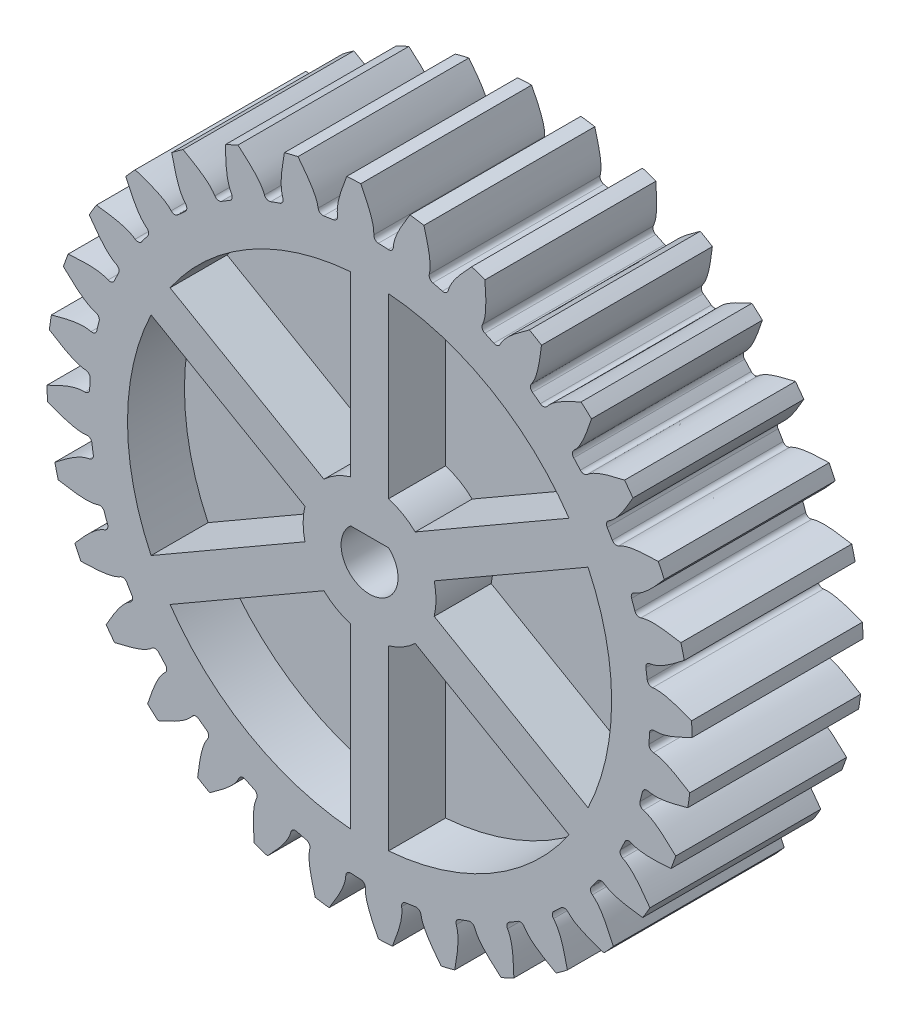
from build123d import *
from build123d.topology import SkipClean

# Parameters (mm, degrees)
ESQUISSE1_R                        = 14.75
BASE_EXTRUSION_DEPTH               = 9
BOSS_EXTRU_1_DEPTH                 = 9
CONG_1_R                           = 0.25
R_P_TITION_CIRCULAIRE1_COUNT       = 32
CONG_1_OF_R_P_TITION_CIRCULAIRE1_R = 0.25
ENL_V_MAT_EXTRU_2_DEPTH            = 26.662667175
BOSS_EXTRU_2_START                 = 5
ESQUISSE5_R                        = 3.5
BOSS_EXTRU_2_DEPTH                 = 5
ENL_V_START                        = -3
ENL_V_MAT_EXTRU_4_DEPTH            = 3
R_P_TITION_CIRCULAIRE2_COUNT       = 6
SYM_TRIE1_START                    = -3
SYM_TRIE1_COPY_1_DEPTH             = 3
SYM_TRIE1_COPY_2_DEPTH             = 3
SYM_TRIE1_COPY_3_DEPTH             = 3
SYM_TRIE1_COPY_4_DEPTH             = 3
SYM_TRIE1_COPY_5_DEPTH             = 3


# Read off the part's stored shape, not the designer's step: Boss.-Extru.1
with BuildPart() as part:
    # Esquisse1 → Base-Extrusion (new body)
    with BuildSketch(Plane.XY):
        Circle(ESQUISSE1_R)
    extrude(amount=BASE_EXTRUSION_DEPTH)

    # Boss.-Extru.1 outline → Boss.-Extru.1 (add)
    with BuildSketch(Plane.XY):
        with BuildLine():
            ThreePointArc((14.658786944, 1.637823355), (14.732296168, 0.722460814), (14.748701662, -0.195702051))
            add(Edge.make_bspline(
                [(14.748701662, -0.195702051), (14.843220422, -0.212864525), (15.265923378, -0.25770261), (16.050131741, -0.009955004), (16.668935437, 0.299779983), (16.993711748, 0.462342985)],
                knots=[0.34511947, 0.34511947, 0.34511947, 0.34511947, 0.424486026, 0.697944103, 1, 1, 1, 1], degree=3))
            ThreePointArc((16.993711748, 0.462342985), (16.979595583, 0.832666701), (16.957410355, 1.202594716))
            add(Edge.make_bspline(
                [(16.957410355, 1.202594716), (16.618286686, 1.332600558), (15.972146643, 1.580303648), (15.167460614, 1.750133059), (14.751172957, 1.664151499), (14.658786944, 1.637823355)],
                knots=[0, 0, 0, 0, 0.302055897, 0.575513974, 0.65488053, 0.65488053, 0.65488053, 0.65488053], degree=3))
        make_face()
    boss_extru_1 = extrude(amount=BOSS_EXTRU_1_DEPTH)

    # Congé1
    cong_1_edges = [part.edges().sort_by_distance(p)[0] for p in [
        (14.748701662, -0.195702051, 4.5),
        (14.658786944, 1.637823355, 4.5),
    ]]
    fillet(cong_1_edges, radius=CONG_1_R)

    # Répétition circulaire1: Boss.-Extru.1 ×32 about axis
    r_p_tition_circulaire1_axis = Axis((0, 0, -50), (0, 0, 1))
    for i in range(1, R_P_TITION_CIRCULAIRE1_COUNT):
        add(boss_extru_1.rotate(r_p_tition_circulaire1_axis, i * 360 / R_P_TITION_CIRCULAIRE1_COUNT))

    # Congé1 of Répétition circulaire1
    cong_1_of_r_p_tition_circulaire1_edges = [part.edges().sort_by_distance(p)[0] for p in [
        (14.503489071, 2.685387266, 4.5),
        (14.057598978, 4.466140504, 4.5),
        (13.700915529, 5.463278656, 4.5),
        (12.916185366, 7.122826378, 4.5),
        (12.371823487, 8.031219311, 4.5),
        (11.278409994, 9.505786028, 4.5),
        (10.567289206, 10.290524712, 4.5),
        (9.207211651, 11.523443653, 4.5),
        (8.356659928, 12.154371019, 4.5),
        (6.782185328, 13.0982618, 4.5),
        (5.824888894, 13.551131664, 4.5),
        (4.096523426, 14.169721092, 4.5),
        (3.069270648, 14.427129919, 4.5),
        (1.253434427, 14.696645949, 4.5),
        (0.195702051, 14.748701662, 4.5),
        (-1.637823355, 14.658786944, 4.5),
        (-2.685387266, 14.503489071, 4.5),
        (-4.466140504, 14.057598978, 4.5),
        (-5.463278656, 13.700915529, 4.5),
        (-7.122826378, 12.916185366, 4.5),
        (-8.031219311, 12.371823487, 4.5),
        (-9.505786028, 11.278409994, 4.5),
        (-10.290524712, 10.567289206, 4.5),
        (-11.523443653, 9.207211651, 4.5),
        (-12.154371019, 8.356659928, 4.5),
        (-13.0982618, 6.782185328, 4.5),
        (-13.551131664, 5.824888894, 4.5),
        (-14.169721092, 4.096523426, 4.5),
        (-14.427129919, 3.069270648, 4.5),
        (-14.696645949, 1.253434427, 4.5),
        (-14.748701662, 0.195702051, 4.5),
        (-14.658786944, -1.637823355, 4.5),
        (-14.503489071, -2.685387266, 4.5),
        (-14.057598978, -4.466140504, 4.5),
        (-13.700915529, -5.463278656, 4.5),
        (-12.916185366, -7.122826378, 4.5),
        (-12.371823487, -8.031219311, 4.5),
        (-11.278409994, -9.505786028, 4.5),
        (-10.567289206, -10.290524712, 4.5),
        (-9.207211651, -11.523443653, 4.5),
        (-8.356659928, -12.154371019, 4.5),
        (-6.782185328, -13.0982618, 4.5),
        (-5.824888894, -13.551131664, 4.5),
        (-4.096523426, -14.169721092, 4.5),
        (-3.069270648, -14.427129919, 4.5),
        (-1.253434427, -14.696645949, 4.5),
        (-0.195702051, -14.748701662, 4.5),
        (1.637823355, -14.658786944, 4.5),
        (2.685387266, -14.503489071, 4.5),
        (4.466140504, -14.057598978, 4.5),
        (5.463278656, -13.700915529, 4.5),
        (7.122826378, -12.916185366, 4.5),
        (8.031219311, -12.371823487, 4.5),
        (9.505786028, -11.278409994, 4.5),
        (10.290524712, -10.567289206, 4.5),
        (11.523443653, -9.207211651, 4.5),
        (12.154371019, -8.356659928, 4.5),
        (13.0982618, -6.782185328, 4.5),
        (13.551131664, -5.824888894, 4.5),
        (14.169721092, -4.096523426, 4.5),
        (14.427129919, -3.069270648, 4.5),
        (14.696645949, -1.253434427, 4.5),
    ]]
    fillet(cong_1_of_r_p_tition_circulaire1_edges, radius=CONG_1_OF_R_P_TITION_CIRCULAIRE1_R)

    # Esquisse3 → Enlèv. mat.-Extru.2 (cut, through all)
    with BuildSketch(Plane.XY):
        with BuildLine():
            Line((-1, 1.118033989), (1, 1.118033989))
            ThreePointArc((1, 1.118033989), (0, -1.5), (-1, 1.118033989))
        make_face()
    extrude(amount=ENL_V_MAT_EXTRU_2_DEPTH, mode=Mode.SUBTRACT)

    # Esquisse5 → Boss.-Extru.2 (add)
    with BuildSketch(Plane(origin=(0, 0, 0), x_dir=(-1, 0, 0), z_dir=(0, 0, -1)).offset(BOSS_EXTRU_2_START)):
        with Locations(Location((0, 0, 0), (0, 0, 180))):
            Circle(ESQUISSE5_R)
        with BuildLine():
            Line((-1, 1.118033989), (1, 1.118033989))
            ThreePointArc((1, 1.118033989), (0, -1.5), (-1, 1.118033989))
        make_face(mode=Mode.SUBTRACT)
    extrude(amount=-BOSS_EXTRU_2_DEPTH)

    # Esquisse8 → Enlèv. mat.-Extru.4 (cut)
    with BuildSketch(Plane.XY.offset(9).offset(ENL_V_START)):
        with BuildLine():
            Line((1, 3.354101966), (1, 12.710723819))
            ThreePointArc((1, 12.710723819), (6.375, 11.041823898), (10.507809728, 7.221387313))
            Line((10.507809728, 7.221387313), (2.40473751, 2.543076387))
            ThreePointArc((2.40473751, 2.543076387), (1.75, 3.031088913), (1, 3.354101966))
        make_face()
    enl_v_mat_extru_4 = extrude(amount=ENL_V_MAT_EXTRU_4_DEPTH, mode=Mode.SUBTRACT)

    # Répétition circulaire2: Enlèv. mat.-Extru.4 ×6 about axis
    r_p_tition_circulaire2_axis = Axis((0, 0, 0), (0, 0, 1))
    for i in range(1, R_P_TITION_CIRCULAIRE2_COUNT):
        add(enl_v_mat_extru_4.rotate(r_p_tition_circulaire2_axis, i * 360 / R_P_TITION_CIRCULAIRE2_COUNT), mode=Mode.SUBTRACT)

    # Symétrie1: Enlèv. mat.-Extru.4 across plane
    add(enl_v_mat_extru_4.mirror(Plane.XY.offset(4.5)), mode=Mode.SUBTRACT)

    # Symétrie1 copy 1 sketch → Symétrie1 copy 1 (cut)
    with SkipClean():  # the faces are left unmerged after this step: merging them gives an invalid solid
        with BuildSketch(Plane(origin=(0, 0, 0), x_dir=(0.5000000000000001, 0.8660254037844386, 0), z_dir=(0, 0, -1)).offset(SYM_TRIE1_START)):
            with BuildLine():
                Line((1, -3.354101966), (1, -12.710723819))
                ThreePointArc((1, -12.710723819), (6.375, -11.041823898), (10.507809728, -7.221387313))
                Line((10.507809728, -7.221387313), (2.40473751, -2.543076387))
                ThreePointArc((2.40473751, -2.543076387), (1.75, -3.031088913), (1, -3.354101966))
            make_face()
        extrude(amount=SYM_TRIE1_COPY_1_DEPTH, mode=Mode.SUBTRACT)

    # Symétrie1 copy 2 sketch → Symétrie1 copy 2 (cut)
    with SkipClean():  # the faces are left unmerged after this step: merging them gives an invalid solid
        with BuildSketch(Plane(origin=(0, 0, 0), x_dir=(-0.4999999999999998, 0.8660254037844387, 0), z_dir=(0, 0, -1)).offset(SYM_TRIE1_START)):
            with BuildLine():
                Line((1, -3.354101966), (1, -12.710723819))
                ThreePointArc((1, -12.710723819), (6.375, -11.041823898), (10.507809728, -7.221387313))
                Line((10.507809728, -7.221387313), (2.40473751, -2.543076387))
                ThreePointArc((2.40473751, -2.543076387), (1.75, -3.031088913), (1, -3.354101966))
            make_face()
        extrude(amount=SYM_TRIE1_COPY_2_DEPTH, mode=Mode.SUBTRACT)

    # Symétrie1 copy 3 sketch → Symétrie1 copy 3 (cut)
    with SkipClean():  # the faces are left unmerged after this step: merging them gives an invalid solid
        with BuildSketch(Plane(origin=(0, 0, 0), x_dir=(-1, 0, 0), z_dir=(0, 0, -1)).offset(SYM_TRIE1_START)):
            with BuildLine():
                Line((1, -3.354101966), (1, -12.710723819))
                ThreePointArc((1, -12.710723819), (6.375, -11.041823898), (10.507809728, -7.221387313))
                Line((10.507809728, -7.221387313), (2.40473751, -2.543076387))
                ThreePointArc((2.40473751, -2.543076387), (1.75, -3.031088913), (1, -3.354101966))
            make_face()
        extrude(amount=SYM_TRIE1_COPY_3_DEPTH, mode=Mode.SUBTRACT)

    # Symétrie1 copy 4 sketch → Symétrie1 copy 4 (cut)
    with SkipClean():  # the faces are left unmerged after this step: merging them gives an invalid solid
        with BuildSketch(Plane(origin=(0, 0, 0), x_dir=(-0.5000000000000004, -0.8660254037844384, 0), z_dir=(0, 0, -1)).offset(SYM_TRIE1_START)):
            with BuildLine():
                Line((1, -3.354101966), (1, -12.710723819))
                ThreePointArc((1, -12.710723819), (6.375, -11.041823898), (10.507809728, -7.221387313))
                Line((10.507809728, -7.221387313), (2.40473751, -2.543076387))
                ThreePointArc((2.40473751, -2.543076387), (1.75, -3.031088913), (1, -3.354101966))
            make_face()
        extrude(amount=SYM_TRIE1_COPY_4_DEPTH, mode=Mode.SUBTRACT)

    # Symétrie1 copy 5 sketch → Symétrie1 copy 5 (cut)
    with SkipClean():  # the faces are left unmerged after this step: merging them gives an invalid solid
        with BuildSketch(Plane(origin=(0, 0, 0), x_dir=(0.5000000000000001, -0.8660254037844386, 0), z_dir=(0, 0, -1)).offset(SYM_TRIE1_START)):
            with BuildLine():
                Line((1, -3.354101966), (1, -12.710723819))
                ThreePointArc((1, -12.710723819), (6.375, -11.041823898), (10.507809728, -7.221387313))
                Line((10.507809728, -7.221387313), (2.40473751, -2.543076387))
                ThreePointArc((2.40473751, -2.543076387), (1.75, -3.031088913), (1, -3.354101966))
            make_face()
        extrude(amount=SYM_TRIE1_COPY_5_DEPTH, mode=Mode.SUBTRACT)


solid = part.part
